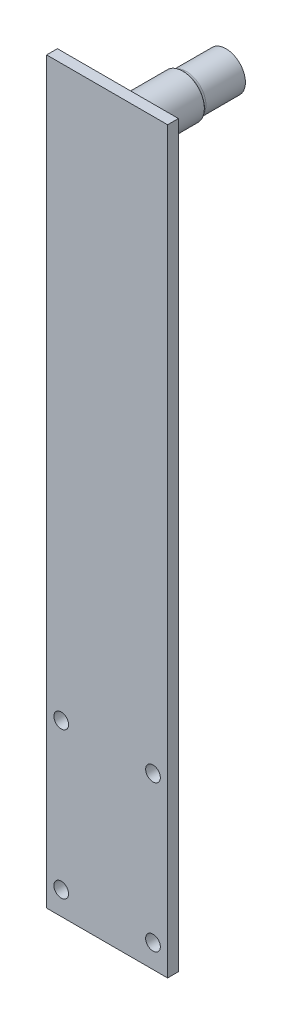
from build123d import *

# Parameters (mm, degrees)
SKETCH_1_W             = 56
SKETCH_1_H             = 89.4
EXTRUDE_1_DEPTH        = 5
HOLE_WIZARD_M8_2_D     = 6.8
HOLE_WIZARD_M8_2_DEPTH = 19.75
HOLE_WIZARD_M8_2_TIP   = 2.042926105
SKETCH_7_W             = 56
SKETCH_7_H             = 5
EXTRUDE_2_DEPTH        = 252.5709
SKETCH_8_R             = 10
EXTRUDE_3_DEPTH        = 30
SKETCH_9_R             = 9
EXTRUDE_4_DEPTH        = 20
FILLET_1_R             = 2
EXTRUDE_START          = -20
SKETCH_10_R            = 9
EXTRUDE_5_DEPTH        = 35
SKETCH_11_R            = 8
CUT_EXTRUDE_1_DEPTH    = 40
SKETCH_12_R            = 8
CUT_EXTRUDE_2_DEPTH    = 45


with BuildPart() as part:
    # 草图1 → 凸台-拉伸1 (new body)
    with BuildSketch(Plane.XY):
        with Locations((28, -44.7)):
            Rectangle(SKETCH_1_W, SKETCH_1_H)
    extrude(amount=EXTRUDE_1_DEPTH)

    # M8 螺纹孔2
    with Locations(Plane.XY.offset(5)):
        with Locations((49.234030414, -78.598612839), (49.234030414, -10.801387161), (6.765969586, -10.801387161), (6.765969586, -78.598612839)):
            Hole(HOLE_WIZARD_M8_2_D / 2, depth=HOLE_WIZARD_M8_2_DEPTH)
            with Locations((0, 0, -(HOLE_WIZARD_M8_2_DEPTH + HOLE_WIZARD_M8_2_TIP / 2))):  # 118° drill point
                Cone(0, HOLE_WIZARD_M8_2_D / 2, HOLE_WIZARD_M8_2_TIP, mode=Mode.SUBTRACT)

    # 草图7 → 凸台-拉伸2 (add)
    with BuildSketch(Plane(origin=(0, 0, 0), x_dir=(1, 0, 0), z_dir=(0, 1, 0))):
        with Locations((28, -2.5)):
            Rectangle(SKETCH_7_W, SKETCH_7_H)
    extrude(amount=EXTRUDE_2_DEPTH)

    # 草图8 → 凸台-拉伸3 (add)
    with BuildSketch(Plane(origin=(0, 0, 0), x_dir=(-1, 0, 0), z_dir=(0, 0, -1))):
        with Locations(Location((-28, 232.5709, 0), (0, 0, 180))):
            Circle(SKETCH_8_R)
    extrude(amount=EXTRUDE_3_DEPTH)

    # 草图9 → 凸台-拉伸4 (add)
    with BuildSketch(Plane(origin=(0, 0, -30), x_dir=(-1, 0, 0), z_dir=(0, 0, -1))):
        with Locations((-28, 232.5709)):
            Circle(SKETCH_9_R)
    extrude(amount=EXTRUDE_4_DEPTH)

    # 圆角1
    # the kernel refuses this fillet: 2 mm, written as the material it adds along each edge
    with BuildSketch(Plane(origin=(28, 232.5709, -30), x_dir=(-1, 0, 0), z_dir=(0, -1, 0))) as fillet_1_piece_1:
        with BuildLine():
            CenterArc((11, 1.732050808), FILLET_1_R, 180, 60)
            Line((9, 1.732050808), (8.96, 1.732050808))
            Line((8.96, 1.732050808), (8.96, 0))
            Line((8.96, 0), (9, -0.04))
            ThreePointArc((9, -0.04), (9.5, -0.04), (9.98, -0.034641016))
            Line((9.98, -0.034641016), (10, 0))
        make_face()
    revolve(axis=Axis((28, 232.5709, -30), (0, 0, -1)))

    # 草图10 → 凸台-拉伸5 (add)
    with BuildSketch(Plane(origin=(0, 252.5709, 0), x_dir=(1, 0, 0), z_dir=(0, 1, 0)).offset(EXTRUDE_START)):
        with Locations(Location((28, 15, 0), (0, 0, 270))):
            Circle(SKETCH_10_R)
    extrude(amount=-EXTRUDE_5_DEPTH)

    # 草图11 → 切除-拉伸1 (cut)
    with BuildSketch(Plane.XZ.offset(-197.5709)):
        with Locations(Location((28, -15, 0), (0, 0, 270))):
            Circle(SKETCH_11_R)
    extrude(amount=-CUT_EXTRUDE_1_DEPTH, mode=Mode.SUBTRACT)

    # 草图12 → 切除-拉伸2 (cut)
    with BuildSketch(Plane(origin=(0, 0, -50), x_dir=(-1, 0, 0), z_dir=(0, 0, -1))):
        with Locations((-28, 232.5709)):
            Circle(SKETCH_12_R)
    extrude(amount=-CUT_EXTRUDE_2_DEPTH, mode=Mode.SUBTRACT)


solid = part.part
